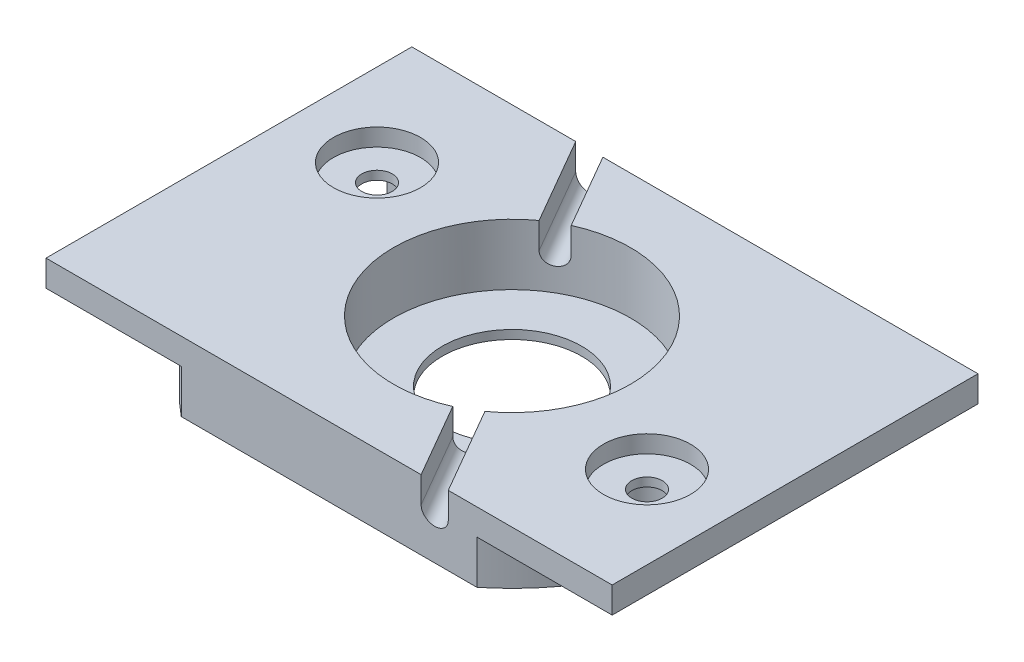
from build123d import *

# Parameters (mm, degrees)
SCHIZZO1_R                        = 27
ESTRUSIONE_ESTRUSIONE1_DEPTH      = 1
SCHIZZO2_R                        = 8
TAGLIO_ESTRUSIONE1_DEPTH          = 39.19685851
SCHIZZO3_R                        = 27
SCHIZZO3_R_2                      = 13.6
ESTRUSIONE_ESTRUSIONE2_DEPTH      = 5
ESTRUSIONE_ESTRUSIONE3_DEPTH      = 2
ESTRUSIONE_ESTRUSIONE3_DEPTH_BACK = 1
SCHIZZO5_W                        = 65
SCHIZZO5_H                        = 42
SCHIZZO5_R                        = 13.6
TAGLIO_ESTRUSIONE2_START          = -27
TAGLIO_ESTRUSIONE2_OUTLINE_R      = 1.35
TAGLIO_ESTRUSIONE2_DEPTH          = 53.999999754
TAGLIO_ESTRUSIONE3_DEPTH          = 44.869308585
TAGLIO_ESTRUSIONE3_DEPTH_BACK     = 44.869308585
SCHIZZO8_W                        = 81.46070362
SCHIZZO8_H                        = 59.010327036
SCHIZZO8_W_2                      = 65
SCHIZZO8_H_2                      = 42
TAGLIO_ESTRUSIONE5_DEPTH          = 43.676105804
TAGLIO_ESTRUSIONE6_DEPTH          = 5
SCHIZZO13_R                       = 5
TAGLIO_ESTRUSIONE8_DEPTH          = 2
TAGLIO_ESTRUSIONE9_DEPTH          = 63.725779509
TAGLIO_ESTRUSIONE9_DEPTH_BACK     = 63.725779509
SCHIZZO3D3_R                      = 1.75


# Read off the part's stored shape, not the designer's step: Taglio-Estrusione2
with BuildPart() as part:
    # Schizzo1 → Estrusione-Estrusione1 (new body)
    with BuildSketch(Plane(origin=(0, 0, 0), x_dir=(1, 0, 0), z_dir=(0, 1, 0))):
        with Locations(Location((0, 0, 0), (0, 0, 270))):
            Circle(SCHIZZO1_R)
    extrude(amount=ESTRUSIONE_ESTRUSIONE1_DEPTH)

    # Schizzo2 → Taglio-Estrusione1 (cut, through all)
    with BuildSketch(Plane(origin=(0, 1, 0), x_dir=(1, 0, 0), z_dir=(0, 1, 0))):
        with Locations(Location((0, 0, 0), (0, 0, 270))):
            Circle(SCHIZZO2_R)
    extrude(amount=-TAGLIO_ESTRUSIONE1_DEPTH, mode=Mode.SUBTRACT)

    # Schizzo3 → Estrusione-Estrusione2 (add)
    with BuildSketch(Plane(origin=(0, 1, 0), x_dir=(1, 0, 0), z_dir=(0, 1, 0))):
        with Locations(Location((0, 0, 0), (0, 0, 270))):
            Circle(SCHIZZO3_R)
        with Locations(Location((0, 0, 0), (0, 0, 270))):
            Circle(SCHIZZO3_R_2, mode=Mode.SUBTRACT)
    extrude(amount=ESTRUSIONE_ESTRUSIONE2_DEPTH)

    # Schizzo5 → Estrusione-Estrusione3 (add, two sides: drawn at the far end of the back side and taken through both)
    with BuildSketch(Plane(origin=(0, 6, 0), x_dir=(1, 0, 0), z_dir=(0, 1, 0)).offset(-ESTRUSIONE_ESTRUSIONE3_DEPTH_BACK)):
        Rectangle(SCHIZZO5_W, SCHIZZO5_H)
        with Locations(Location((0, 0, 0), (0, 0, 270))):
            Circle(SCHIZZO5_R, mode=Mode.SUBTRACT)
    extrude(amount=ESTRUSIONE_ESTRUSIONE3_DEPTH + ESTRUSIONE_ESTRUSIONE3_DEPTH_BACK)

    # Taglio-Estrusione2 outline → Taglio-Estrusione2 (cut)
    with BuildSketch(Plane(origin=(0, 0, 0), x_dir=(0.866025403784438, 0, -0.500000000000001), z_dir=(0.500000000000001, 0, 0.866025403784438)).offset(TAGLIO_ESTRUSIONE2_START)):
        with Locations((0, 5)):
            Circle(TAGLIO_ESTRUSIONE2_OUTLINE_R)
    extrude(amount=TAGLIO_ESTRUSIONE2_DEPTH, mode=Mode.SUBTRACT)

    # Schizzo3D2 → Taglio-Estrusione3 (cut, two sides: drawn at the far end of the back side and taken through both)
    with BuildSketch(Plane(origin=(1.169134295, 5, -0.675), x_dir=(-0.41149103074101084, 0.8799053976571924, 0.23757445736745078), z_dir=(-0.5000000000000011, 1.0747888534457561e-14, -0.866025403784438)).offset(-TAGLIO_ESTRUSIONE3_DEPTH_BACK)):
        Polygon((0, 0), (1.28290207, -2.375744574), (5.682429058, 0), (4.399526988, 2.375744574), align=None)
    extrude(amount=TAGLIO_ESTRUSIONE3_DEPTH + TAGLIO_ESTRUSIONE3_DEPTH_BACK, mode=Mode.SUBTRACT)

    # Schizzo8 → Taglio-Estrusione5 (cut, through all)
    with BuildSketch(Plane(origin=(0, 6, 0), x_dir=(1, 0, 0), z_dir=(0, 1, 0))):
        Rectangle(SCHIZZO8_W, SCHIZZO8_H)
        Rectangle(SCHIZZO8_W_2, SCHIZZO8_H_2, mode=Mode.SUBTRACT)
    extrude(amount=-TAGLIO_ESTRUSIONE5_DEPTH, mode=Mode.SUBTRACT)

    # Schizzo9 → Taglio-Estrusione6 (cut)
    with BuildSketch(Plane.XZ):
        with BuildLine():
            Line((-22.997958605, -4.5), (-26.622359024, -4.5))
            Line((-26.622359024, -4.5), (-26.622359024, -10.5))
            Line((-26.622359024, -10.5), (-22.997958605, -10.5))
            ThreePointArc((-22.997958605, -10.5), (-19.997958605, -7.5), (-22.997958605, -4.5))
        make_face()
        with BuildLine():
            Line((22.997958605, 4.5), (27.800743069, 4.5))
            Line((27.800743069, 4.5), (27.800743069, 10.5))
            Line((27.800743069, 10.5), (22.997958605, 10.5))
            ThreePointArc((22.997958605, 10.5), (19.997958605, 7.5), (22.997958605, 4.5))
        make_face()
    extrude(amount=-TAGLIO_ESTRUSIONE6_DEPTH, mode=Mode.SUBTRACT)

    # Schizzo13 → Taglio-Estrusione8 (cut)
    with BuildSketch(Plane(origin=(0, 8, 0), x_dir=(1, 0, 0), z_dir=(0, 1, 0))):
        with Locations(Location((-22.997958605, 7.5, 0), (0, 0, 270))):
            Circle(SCHIZZO13_R)
        with Locations(Location((22.997958605, -7.5, 0), (0, 0, 270))):
            Circle(SCHIZZO13_R)
    extrude(amount=-TAGLIO_ESTRUSIONE8_DEPTH, mode=Mode.SUBTRACT)

    # Schizzo3D3 → Taglio-Estrusione9 (cut, two sides: drawn at the far end of the back side and taken through both)
    with BuildSketch(Plane(origin=(-22.997958605, 6.5, -7.5), x_dir=(0.9507217281959008, 0, 0.3100454733360893), z_dir=(0, -1, 0)).offset(-TAGLIO_ESTRUSIONE9_DEPTH_BACK)):
        with Locations(Location((0, 0, 0), (0, 0, 71.938029054))):
            Circle(SCHIZZO3D3_R)
        with Locations(Location((48.38, 0, 0), (0, 0, 71.938029054))):
            Circle(SCHIZZO3D3_R)
    extrude(amount=TAGLIO_ESTRUSIONE9_DEPTH + TAGLIO_ESTRUSIONE9_DEPTH_BACK, mode=Mode.SUBTRACT)


solid = part.part
